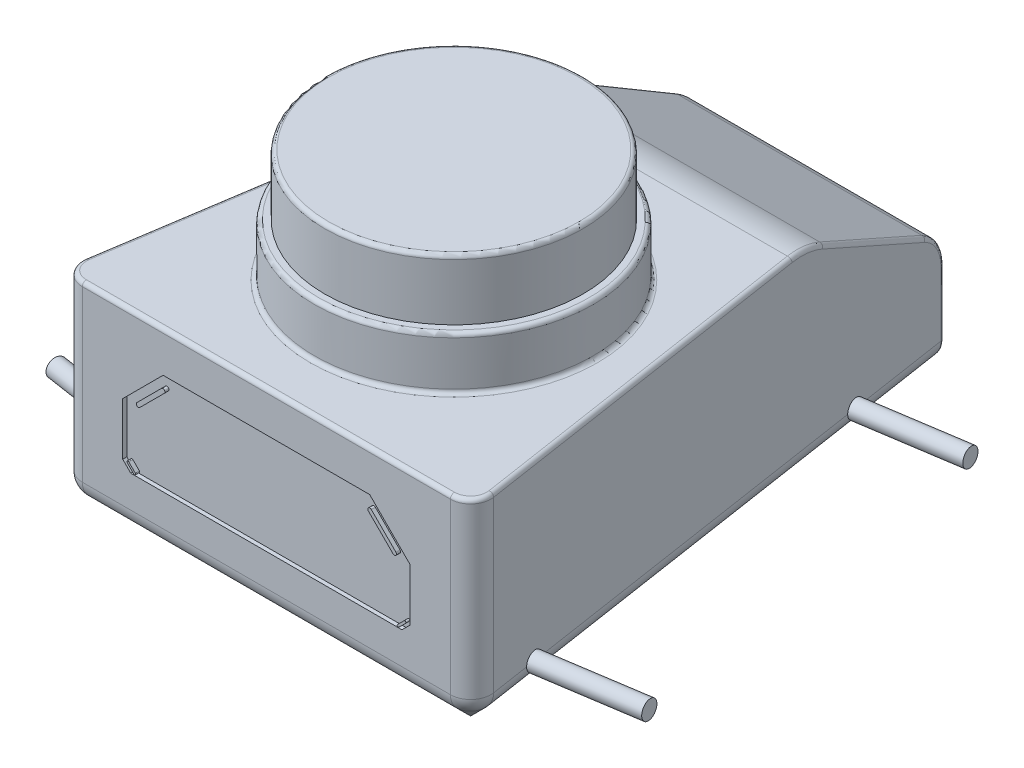
from build123d import *

# Parameters (mm, degrees)
BOSS_EXTRUDE1_DEPTH = 50
CUT_EXTRUDE5_DEPTH  = 55.5
FILLET2_R           = 20
FILLET3_R           = 10
FILLET4_R           = 5
CHAMFER2_SIZE       = 5
CUT_EXTRUDE6_DEPTH  = 1
FILLET5_R           = 5
FILLET6_R           = 1
SKETCH8_R           = 34.527500296
BOSS_EXTRUDE2_DEPTH = 13
FILLET7_R           = 1
FILLET8_R           = 1
SKETCH9_R           = 32
BOSS_EXTRUDE3_DEPTH = 15
FILLET9_R           = 1
SKETCH10_R          = 2.25
BOSS_EXTRUDE4_DEPTH = 25
SKETCH11_R          = 2.25
SKETCH11_R_2        = 2.25463414
BOSS_EXTRUDE5_DEPTH = 25


with BuildPart() as part:
    # Sketch1 → Boss-Extrude1 (new body)
    with BuildSketch(Plane(origin=(0, 0, 0), x_dir=(1, 0, 0), z_dir=(0, 1, 0))):
        Polygon((-51.398092619, 0), (51.398092619, 0), (30.341353011, 137.38084809), (-30.341353011, 137.38084809), align=None)
    extrude(amount=BOSS_EXTRUDE1_DEPTH)

    # Sketch6 → Cut-Extrude5 (cut, symmetric)
    with BuildSketch(Plane(origin=(0, 0, 0), x_dir=(0, 0, -1), z_dir=(1, 0, 0))):
        Polygon((92.469674373, 52.824174353), (139.292734298, 28.064336383), (139.292734298, 52.824174353), align=None)
    extrude(amount=CUT_EXTRUDE5_DEPTH, both=True, mode=Mode.SUBTRACT)

    # Fillet2
    fillet2_edges = [part.edges().sort_by_distance(p)[0] for p in [
        (0, 50, -97.810439735),
    ]]
    fillet(fillet2_edges, radius=FILLET2_R)

    # Fillet3
    fillet3_edges = [part.edges().sort_by_distance(p)[0] for p in [
        (0, 29.075333802, -137.38084809),
    ]]
    fillet(fillet3_edges, radius=FILLET3_R)

    # Fillet4
    fillet4_edges = [part.edges().sort_by_distance(p)[0] for p in [
        (51.398092619, 25, 0),
        (-51.398092619, 25, 0),
    ]]
    fillet(fillet4_edges, radius=FILLET4_R)

    # Chamfer2
    chamfer2_edges = [part.edges().sort_by_distance(p)[0] for p in [
        (0, 0, 0),
        (40.428487571, 0, -71.569182732),
        (49.367253823, 0, -1.743282855),
        (-49.367253823, 0, -1.743282855),
        (-40.428487571, 0, -71.569182732),
    ]]
    chamfer(chamfer2_edges, length=CHAMFER2_SIZE)

    # Sketch7 → Cut-Extrude6 (cut)
    with BuildSketch(Plane.XY):
        Polygon((-35.573338506, 17), (-33.573338506, 15), (33.573338506, 15), (35.573338506, 17), (35.573338506, 30), (25.573338506, 40), (-25.573338506, 40), (-35.573338506, 30), align=None)
        with BuildLine():
            Line((-25.266365334, 36.288148586), (-31.365780319, 30.1887336))
            ThreePointArc((-31.365780319, 30.1887336), (-32.0728871, 30.1887336), (-32.0728871, 30.895840382))
            Line((-32.0728871, 30.895840382), (-25.973472115, 36.995255367))
            ThreePointArc((-25.973472115, 36.995255367), (-25.266365334, 36.995255367), (-25.266365334, 36.288148586))
        make_face(mode=Mode.SUBTRACT)
        with BuildLine():
            Line((-34.078531496, 17.189532522), (-32.459493974, 15.570495001))
            ThreePointArc((-32.459493974, 15.570495001), (-32.459493974, 15.191429956), (-32.838559018, 15.191429956))
            Line((-32.838559018, 15.191429956), (-34.45759654, 16.810467478))
            ThreePointArc((-34.45759654, 16.810467478), (-34.45759654, 17.189532522), (-34.078531496, 17.189532522))
        make_face(mode=Mode.SUBTRACT)
        with BuildLine():
            Line((25.266365334, 36.288148586), (31.365780319, 30.1887336))
            ThreePointArc((31.365780319, 30.1887336), (32.0728871, 30.1887336), (32.0728871, 30.895840382))
            Line((32.0728871, 30.895840382), (25.973472115, 36.995255367))
            ThreePointArc((25.973472115, 36.995255367), (25.266365334, 36.995255367), (25.266365334, 36.288148586))
        make_face(mode=Mode.SUBTRACT)
        with BuildLine():
            Line((34.078531496, 17.189532522), (32.459493974, 15.570495001))
            ThreePointArc((32.459493974, 15.570495001), (32.459493974, 15.191429956), (32.838559018, 15.191429956))
            Line((32.838559018, 15.191429956), (34.45759654, 16.810467478))
            ThreePointArc((34.45759654, 16.810467478), (34.45759654, 17.189532522), (34.078531496, 17.189532522))
        make_face(mode=Mode.SUBTRACT)
    extrude(amount=-CUT_EXTRUDE6_DEPTH, mode=Mode.SUBTRACT)

    # Fillet5
    fillet5_edges = [part.edges().sort_by_distance(p)[0] for p in [
        (-40.428487571, 5, -71.569182732),
        (40.428487571, 5, -71.569182732),
        (-49.367253823, 5, -1.743282855),
        (49.367253823, 5, -1.743282855),
        (0, 5, 0),
    ]]
    fillet(fillet5_edges, radius=FILLET5_R)

    # Fillet6
    fillet6_edges = [part.edges().sort_by_distance(p)[0] for p in [
        (27.071373693, 1.767766953, -137.38084809),
        (29.955132562, 5.154852891, -137.38084809),
        (-29.955132562, 5.154852891, -137.38084809),
        (-43.841321308, 50, -49.302772931),
        (-33.44581189, 39.785815035, -117.126373678),
        (-36.429266086, 49.412153985, -97.661372195),
        (36.429266086, 49.412153985, -97.661372195),
        (-30.341353011, 15.061154294, -137.38084809),
        (30.341353011, 15.061154294, -137.38084809),
        (33.44581189, 39.785815035, -117.126373678),
        (30.562262133, 28.223119759, -135.939566906),
        (-30.562262133, 28.223119759, -135.939566906),
        (0, 50, 0),
        (43.841321308, 50, -49.302772931),
        (49.367253823, 50, -1.743282855),
        (-49.367253823, 50, -1.743282855),
        (-27.071373693, 1.767766953, -137.38084809),
    ]]
    fillet(fillet6_edges, radius=FILLET6_R)

    # Sketch8 → Boss-Extrude2 (add)
    with BuildSketch(Plane(origin=(0, 50, 0), x_dir=(1, 0, 0), z_dir=(0, 1, 0))):
        with Locations(Location((0, 46.424014243, 0), (0, 0, 90))):
            Circle(SKETCH8_R)
    extrude(amount=BOSS_EXTRUDE2_DEPTH)

    # Fillet7
    fillet7_edges = [part.edges().sort_by_distance(p)[0] for p in [
        (0, 63, -11.896513947),
    ]]
    fillet(fillet7_edges, radius=FILLET7_R)

    # Fillet8
    fillet8_edges = [part.edges().sort_by_distance(p)[0] for p in [
        (0, 50, -11.896513947),
    ]]
    fillet(fillet8_edges, radius=FILLET8_R)

    # Sketch9 → Boss-Extrude3 (add)
    with BuildSketch(Plane(origin=(0, 63, 0), x_dir=(1, 0, 0), z_dir=(0, 1, 0))):
        with Locations(Location((0, 46.424014243, 0), (0, 0, 270))):
            Circle(SKETCH9_R)
    extrude(amount=BOSS_EXTRUDE3_DEPTH)

    # Fillet9
    fillet9_edges = [part.edges().sort_by_distance(p)[0] for p in [
        (0, 78, -78.424014243),
    ]]
    fillet(fillet9_edges, radius=FILLET9_R)

    # Sketch10 → Boss-Extrude4 (add)
    with BuildSketch(Plane(origin=(50.21833663, 0, -7.697102272), x_dir=(-0.1515034749062424, 0, -0.9884567249461829), z_dir=(0.9884567249461829, 0, -0.1515034749062424))):
        with Locations((105.037764478, 7.071067812)):
            Circle(SKETCH10_R)
        with Locations((10.037764478, 7.071067812)):
            Circle(SKETCH10_R)
    extrude(amount=BOSS_EXTRUDE4_DEPTH)

    # Sketch11 → Boss-Extrude5 (add)
    with BuildSketch(Plane(origin=(-50.21833663, 0, -7.697102272), x_dir=(-0.1515034749062424, 0, 0.9884567249461829), z_dir=(-0.9884567249461829, 0, -0.1515034749062424))):
        with Locations((-105.037764478, 7.071067812)):
            Circle(SKETCH11_R)
        with Locations((-10.037764478, 7.071067812)):
            Circle(SKETCH11_R_2)
    extrude(amount=BOSS_EXTRUDE5_DEPTH)


solid = part.part
